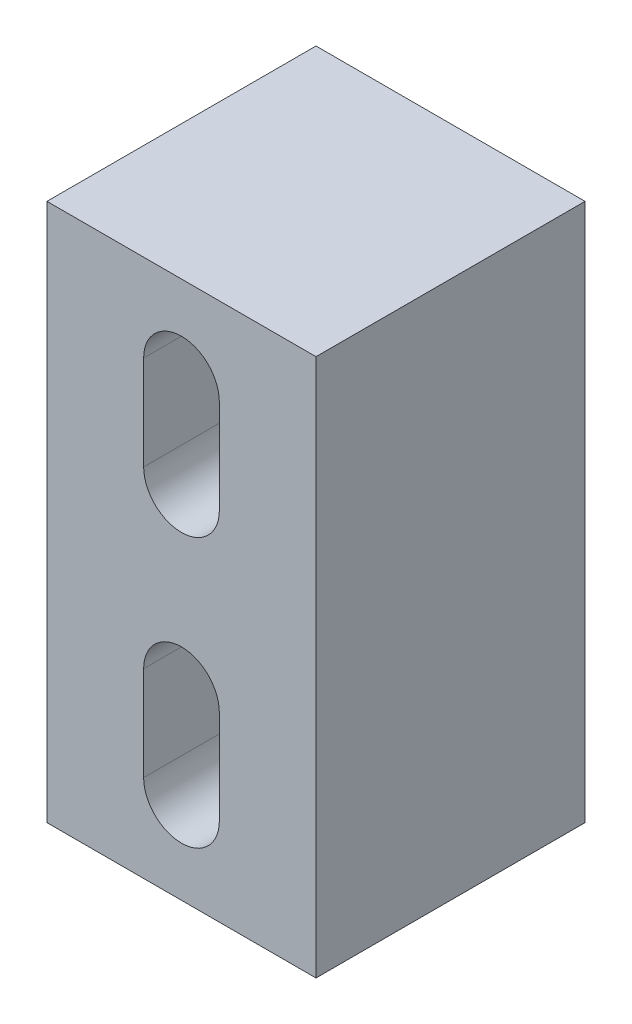
from build123d import *

# Parameters (mm, degrees)
SKETCH1_W                                     = 25.4
SKETCH1_H                                     = 50.8
BOSS_EXTRUDE1_DEPTH                           = 25.4
CBORE_SLOT_FOR_6_SOCKET_HEAD_CAP_SCREW1_DEPTH = 25.4
CBORE_START                                   = 16.89481
CBORE_SLOT_FOR_6_SOCKET_HEAD_CAP_SC_3_DEPTH   = 8.50519


# Read off the part's stored shape, not the designer's step: CBORE SLOT for #6 Socket Head Cap Screw1
with BuildPart() as part:
    # Sketch1 → Boss-Extrude1 (new body)
    with BuildSketch(Plane.XY):
        Rectangle(SKETCH1_W, SKETCH1_H)
    extrude(amount=BOSS_EXTRUDE1_DEPTH)

    # CBORE SLOT for _6 Socket Head Cap Sc 2 → CBORE SLOT for #6 Socket Head Cap Screw1 (cut)
    with BuildSketch(Plane.XY):
        with BuildLine():
            Line((1.89865, -17.15135), (1.89865, -8.24865))
            ThreePointArc((1.89865, -8.24865), (0, -6.35), (-1.89865, -8.24865))
            Line((-1.89865, -8.24865), (-1.89865, -17.15135))
            ThreePointArc((-1.89865, -17.15135), (0, -19.05), (1.89865, -17.15135))
        make_face()
        with BuildLine():
            ThreePointArc((1.89865, 17.15135), (0, 19.05), (-1.89865, 17.15135))
            Line((-1.89865, 17.15135), (-1.89865, 8.24865))
            ThreePointArc((-1.89865, 8.24865), (0, 6.35), (1.89865, 8.24865))
            Line((1.89865, 8.24865), (1.89865, 17.15135))
        make_face()
    extrude(amount=CBORE_SLOT_FOR_6_SOCKET_HEAD_CAP_SCREW1_DEPTH, mode=Mode.SUBTRACT)

    # CBORE SLOT for _6 Socket Head Cap Sc 3 o → CBORE SLOT for _6 Socket Head Cap Sc 3 (cut)
    # profile 1 of 2: a face of its own
    with BuildSketch(Plane.XY.offset(CBORE_START)):
        with BuildLine():
            Line((3.57251, -17.15135), (3.57251, -8.24865))
            ThreePointArc((3.57251, -8.24865), (0, -4.67614), (-3.57251, -8.24865))
            Line((-3.57251, -8.24865), (-3.57251, -17.15135))
            ThreePointArc((-3.57251, -17.15135), (0, -20.72386), (3.57251, -17.15135))
        make_face()
        with BuildLine():
            ThreePointArc((-1.89865, -8.24865), (0, -6.35), (1.89865, -8.24865))
            Line((1.89865, -8.24865), (1.89865, -17.15135))
            ThreePointArc((1.89865, -17.15135), (0, -19.05), (-1.89865, -17.15135))
            Line((-1.89865, -17.15135), (-1.89865, -8.24865))
        make_face(mode=Mode.SUBTRACT)
    # profile 2 of 2: a face of its own
    with BuildSketch(Plane.XY.offset(CBORE_START)):
        with BuildLine():
            ThreePointArc((3.57251, 17.15135), (0, 20.72386), (-3.57251, 17.15135))
            Line((-3.57251, 17.15135), (-3.57251, 8.24865))
            ThreePointArc((-3.57251, 8.24865), (0, 4.67614), (3.57251, 8.24865))
            Line((3.57251, 8.24865), (3.57251, 17.15135))
        make_face()
        with BuildLine():
            Line((-1.89865, 8.24865), (-1.89865, 17.15135))
            ThreePointArc((-1.89865, 17.15135), (0, 19.05), (1.89865, 17.15135))
            Line((1.89865, 17.15135), (1.89865, 8.24865))
            ThreePointArc((1.89865, 8.24865), (0, 6.35), (-1.89865, 8.24865))
        make_face(mode=Mode.SUBTRACT)
    extrude(amount=CBORE_SLOT_FOR_6_SOCKET_HEAD_CAP_SC_3_DEPTH, mode=Mode.SUBTRACT)


solid = part.part
